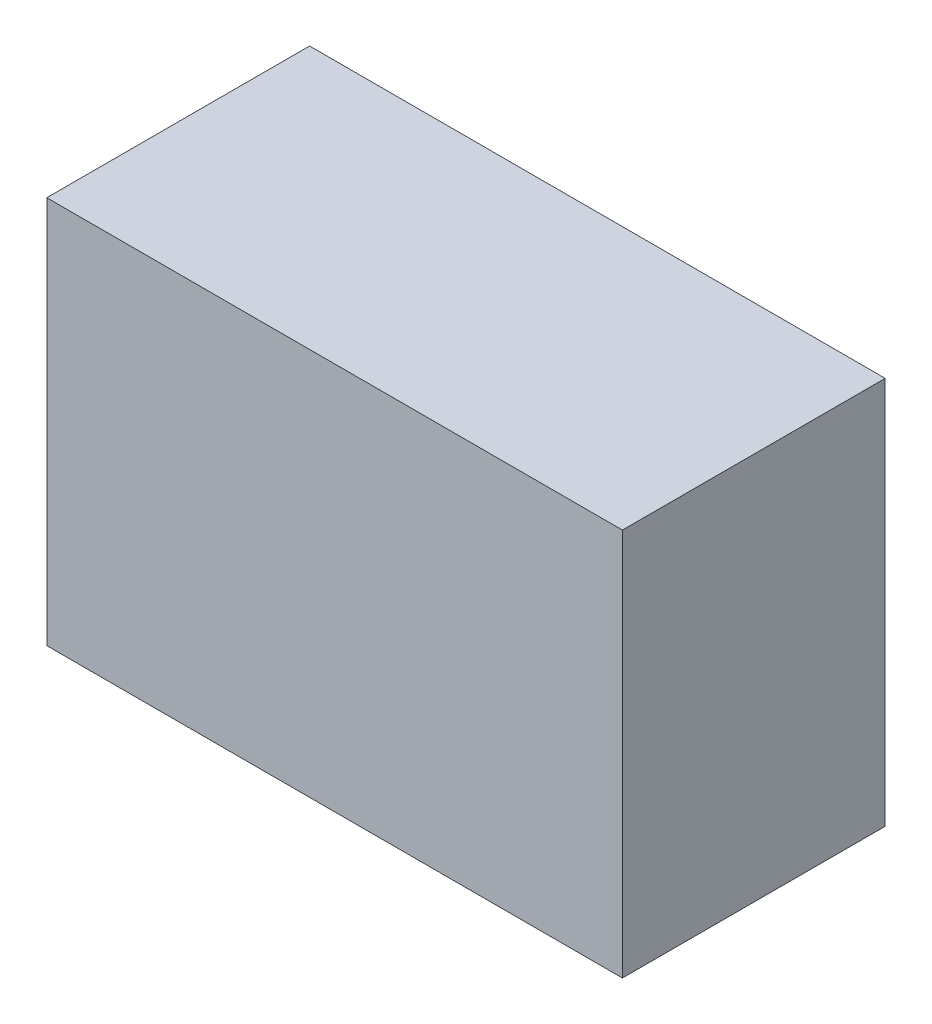
from build123d import *

# Parameters (mm, degrees)
SKETCH_1_W             = 46
SKETCH_1_H             = 31
EXTRUDE_1_DEPTH        = 21
EXTRUDE_2_DEPTH        = 5
EXTRUDE_2_DEPTH_BACK   = 5
SKETCH_2_R             = 1
EXTRUDE_2_2_DEPTH      = 5
EXTRUDE_2_2_DEPTH_BACK = 5


with BuildPart() as part:
    # ｽｹｯﾁ1 → ﾎﾞｽ - 押し出し1 (new body)
    with BuildSketch(Plane.XY):
        with Locations((23, 15.5)):
            Rectangle(SKETCH_1_W, SKETCH_1_H)
    extrude(amount=EXTRUDE_1_DEPTH)


with BuildPart() as body_2:
    # ｽｹｯﾁ2 → ﾎﾞｽ - 押し出し2 (new, two sides: drawn at the far end of the back side and taken through both)
    with BuildSketch(Plane.XZ.offset(-EXTRUDE_2_DEPTH_BACK)):
        with Locations((-1, 11.5)):
            Circle(SKETCH_2_R)
    extrude(amount=EXTRUDE_2_DEPTH + EXTRUDE_2_DEPTH_BACK)


with BuildPart() as body_3:
    # ｽｹｯﾁ2 → Extrude 2 2 (new, two sides: drawn at the far end of the back side and taken through both)
    with BuildSketch(Plane.XZ.offset(-EXTRUDE_2_2_DEPTH_BACK)):
        with Locations((-1, 9.5)):
            Circle(SKETCH_2_R)
    extrude(amount=EXTRUDE_2_2_DEPTH + EXTRUDE_2_2_DEPTH_BACK)


solid = Compound([part.part, body_2.part, body_3.part])
